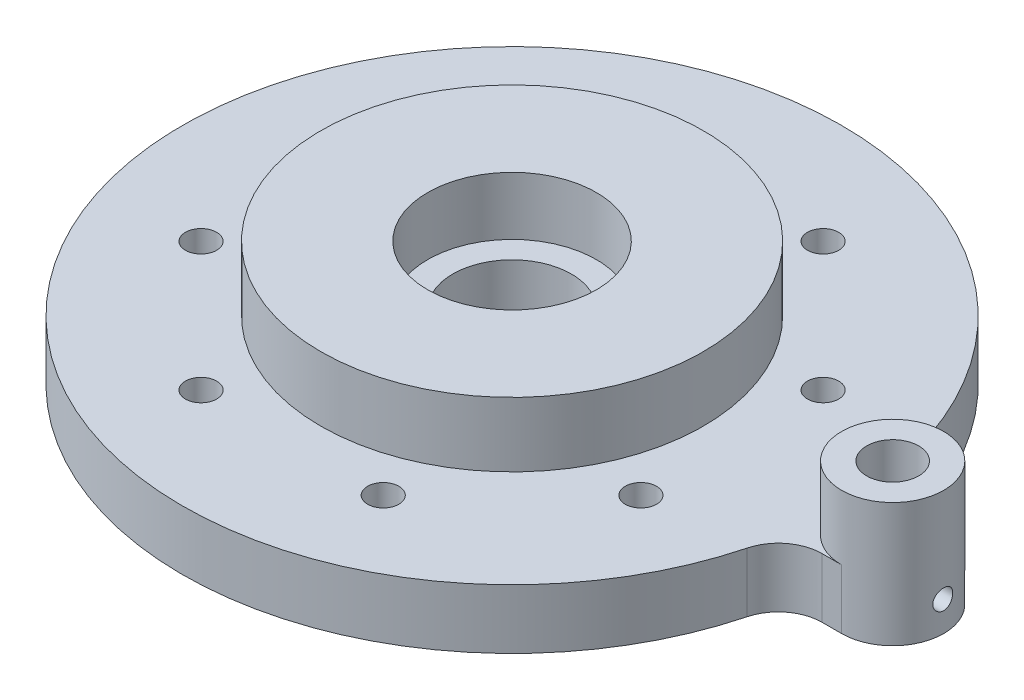
from build123d import *
from build123d.topology import SkipClean

# Parameters (mm, degrees)
BASE_DEPTH                       = 9.525
SKETCH3_R                        = 3.5
SQUARE_BOLT_HOLES_DEPTH          = 7.525
SKETCH4_R                        = 2.5
HOUSING_BOLTS_DEPTH              = 44.33
CIRPATTERN1_COUNT                = 8
SKETCH2_R                        = 30.626685
SKETCH2_R_2                      = 8.1671875
SKETCH2_R_3                      = 4.1671875
IMPELLER_CAVITY_RISER_DEPTH      = 10.32955
SKETCH5_R                        = 13.5
SEAL_BORE_DEPTH                  = 9.3
SKETCH6_R                        = 9.5
BORE_DEPTH                       = 39.3
PRESSURE_TAP_DEPTH               = 120.611937764
PRESSURE_TAP_DEPTH_BACK          = 52.75
SKETCH9_R                        = 1.5875
SKETCH10_R                       = 1.5875
PRESSURE_TAP_VERTICAL_HOLE_DEPTH = 6.35


with BuildPart() as part:
    # Sketch1 → base (new body)
    with BuildSketch(Plane(origin=(0, 0, 0), x_dir=(1, 0, 0), z_dir=(0, 1, 0))):
        with BuildLine():
            Line((57.792896824, 8.1671875), (60.9171875, 8.1671875))
            ThreePointArc((60.9171875, 8.1671875), (69.084375, 0), (60.9171875, -8.1671875))
            Line((60.9171875, -8.1671875), (57.792896824, -8.1671875))
            ThreePointArc((57.792896824, -8.1671875), (53.517289439, -9.624698755), (51.022180878, -13.390278504))
            ThreePointArc((51.022180878, -13.390278504), (-52.75, 0), (51.022180878, 13.390278504))
            ThreePointArc((51.022180878, 13.390278504), (53.517289439, 9.624698755), (57.792896824, 8.1671875))
        make_face()
    extrude(amount=BASE_DEPTH)

    # Sketch3 → square bolt holes (cut)
    with BuildSketch(Plane.XZ):
        with Locations((-28.814601333, -28.814601333)):
            Circle(SKETCH3_R)
        with Locations((-28.814601333, 28.814601333)):
            Circle(SKETCH3_R)
        with Locations((28.814601333, 28.814601333)):
            Circle(SKETCH3_R)
        with Locations((28.814601333, -28.814601333)):
            Circle(SKETCH3_R)
    extrude(amount=-SQUARE_BOLT_HOLES_DEPTH, mode=Mode.SUBTRACT)

    # Sketch4 → housing bolts (cut)
    with BuildSketch(Plane(origin=(0, 9.525, 0), x_dir=(1, 0, 0), z_dir=(0, 1, 0))):
        with Locations((14.580238773, 35.199810189)):
            Circle(SKETCH4_R)
    housing_bolts = extrude(amount=-HOUSING_BOLTS_DEPTH, mode=Mode.SUBTRACT)

    # CirPattern1: housing bolts ×8 about axis
    cirpattern1_axis = Axis((0, 9.525, 0), (0, 1, 0))
    for i in range(1, CIRPATTERN1_COUNT):
        add(housing_bolts.rotate(cirpattern1_axis, i * 360 / CIRPATTERN1_COUNT), mode=Mode.SUBTRACT)

    # Sketch2 → impeller cavity riser (add)
    # profile 1 of 2: a face of its own
    with SkipClean():  # the faces are left unmerged after this step: merging them gives an invalid solid
        with BuildSketch(Plane(origin=(0, 9.525, 0), x_dir=(1, 0, 0), z_dir=(0, 1, 0))):
            Circle(SKETCH2_R)
        # profile 2 of 2: a face of its own
        with BuildSketch(Plane(origin=(0, 9.525, 0), x_dir=(1, 0, 0), z_dir=(0, 1, 0))):
            with Locations((60.9171875, 0)):
                Circle(SKETCH2_R_2)
            with Locations((60.9171875, 0)):
                Circle(SKETCH2_R_3, mode=Mode.SUBTRACT)
        extrude(amount=IMPELLER_CAVITY_RISER_DEPTH)
    add(part.part.scale(1), mode=Mode.REPLACE)  # the faces are merged on a copy

    # Sketch5 → seal bore (cut)
    with BuildSketch(Plane(origin=(0, 19.85455, 0), x_dir=(1, 0, 0), z_dir=(0, 1, 0))):
        Circle(SKETCH5_R)
    extrude(amount=-SEAL_BORE_DEPTH, mode=Mode.SUBTRACT)

    # Sketch6 → bore (cut)
    with BuildSketch(Plane(origin=(0, 10.55455, 0), x_dir=(1, 0, 0), z_dir=(0, 1, 0))):
        Circle(SKETCH6_R)
    extrude(amount=-BORE_DEPTH, mode=Mode.SUBTRACT)

    # Sketch9 → pressure tap (cut, two sides: drawn at the far end of the back side and taken through both)
    with BuildSketch(Plane(origin=(52.75, 0, 0), x_dir=(0, 0, -1), z_dir=(1, 0, 0)).offset(-PRESSURE_TAP_DEPTH_BACK)):
        with Locations((0, 4.7625)):
            Circle(SKETCH9_R)
    extrude(amount=PRESSURE_TAP_DEPTH + PRESSURE_TAP_DEPTH_BACK, mode=Mode.SUBTRACT)

    # Sketch10 → pressure tap vertical hole (cut)
    with BuildSketch(Plane(origin=(0, 9.525, 0), x_dir=(1, 0, 0), z_dir=(0, 1, 0))):
        with Locations((60.9171875, 0)):
            Circle(SKETCH10_R)
    extrude(amount=-PRESSURE_TAP_VERTICAL_HOLE_DEPTH, mode=Mode.SUBTRACT)


solid = part.part
